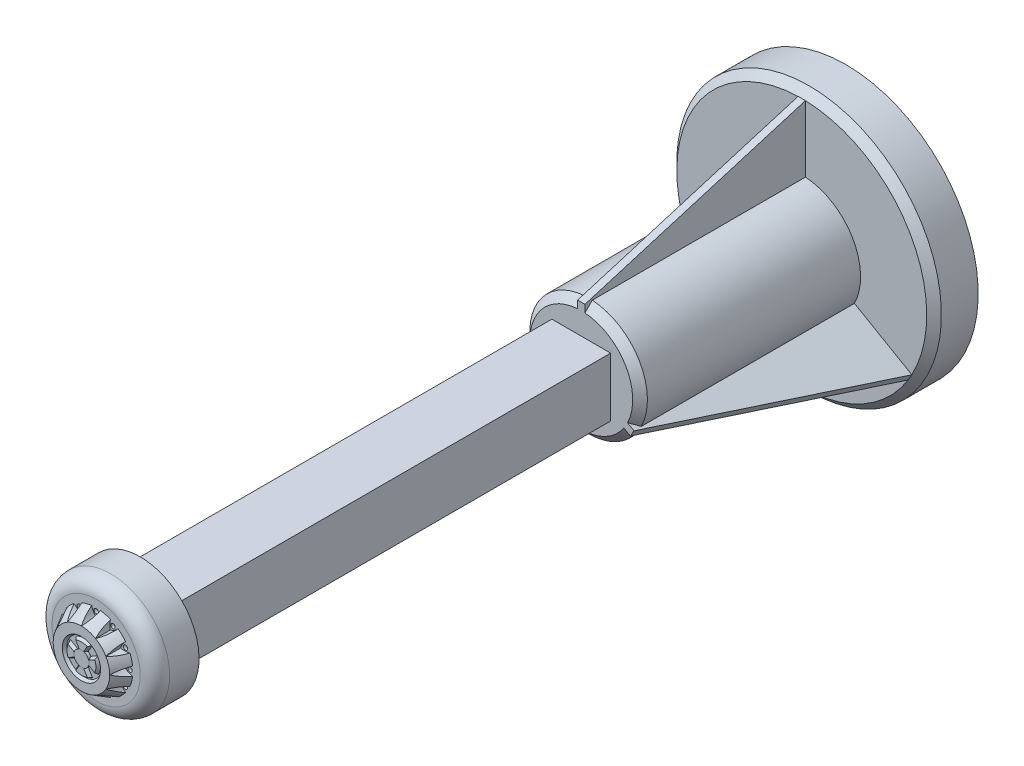
from build123d import *

# Parameters (mm, degrees)
SKETCH1_R                = 90
BOSS_EXTRUDE1_DEPTH      = 30
CHAMFER1_SIZE            = 5
SKETCH2_R                = 40
BOSS_EXTRUDE2_DEPTH      = 150
BOSS_EXTRUDE3_DEPTH      = 2.5
CIRPATTERN1_COUNT        = 3
CHAMFER2_SIZE            = 5
SKETCH6_R                = 10
CUT_EXTRUDE1_DEPTH       = 20
SKETCH7_W                = 40
SKETCH7_H                = 40
BOSS_EXTRUDE4_DEPTH      = 300
SKETCH8_R                = 40
BOSS_EXTRUDE5_DEPTH      = 30
FILLET1_R                = 10
SKETCH9_R                = 25
BOSS_EXTRUDE6_DEPTH      = 10
CHAMFER3_SIZE2           = 5.773502692
CHAMFER3_SIZE            = 10
CUT_EXTRUDE2_START       = -10
CUT_EXTRUDE2_DEPTH       = 10
SKETCH11_R               = 1.5
CUT_EXTRUDE3_DEPTH       = 2
CIRPATTERN2_COUNT        = 12
SKETCH12_R               = 13
CUT_EXTRUDE4_DEPTH       = 2
CUT_EXTRUDE4_DRAFT       = -30
BOSS_EXTRUDE8_DEPTH      = 2
BOSS_EXTRUDE8_DRAFT      = 30
CIRPATTERN3_COPY_1_DEPTH = 2
CIRPATTERN3_COPY_1_DRAFT = 30
CIRPATTERN3_COPY_2_DEPTH = 2
CIRPATTERN3_COPY_2_DRAFT = 30
CIRPATTERN3_COPY_3_DEPTH = 2
CIRPATTERN3_COPY_3_DRAFT = 30
SKETCH14_R               = 5.15
BOSS_EXTRUDE9_DEPTH      = 2
BODY_MOVE_COPY1_ANGLE    = 90


with BuildPart() as part:
    # Sketch1 → Boss-Extrude1 (new body)
    with BuildSketch(Plane(origin=(0, 0, 0), x_dir=(1, 0, 0), z_dir=(0, 1, 0))):
        with Locations(Location((0, 0, 0), (0, 0, 270))):
            Circle(SKETCH1_R)
    extrude(amount=BOSS_EXTRUDE1_DEPTH)

    # Chamfer1
    chamfer1_edges = [part.edges().sort_by_distance(p)[0] for p in [
        (0, 30, -90),
    ]]
    chamfer(chamfer1_edges, length=CHAMFER1_SIZE)

    # Sketch2 → Boss-Extrude2 (add)
    with BuildSketch(Plane(origin=(0, 30, 0), x_dir=(1, 0, 0), z_dir=(0, 1, 0))):
        with Locations(Location((0, 0, 0), (0, 0, 270))):
            Circle(SKETCH2_R)
    extrude(amount=BOSS_EXTRUDE2_DEPTH)

    # Sketch5 → Boss-Extrude3 (add, symmetric)
    with BuildSketch(Plane(origin=(0, 0, 0), x_dir=(0, 0, -1), z_dir=(1, 0, 0))):
        Polygon((0, 30), (0, 180), (40, 180), (85, 30), align=None)
    boss_extrude3 = extrude(amount=BOSS_EXTRUDE3_DEPTH, both=True)

    # CirPattern1: Boss-Extrude3 ×3 about axis
    cirpattern1_axis = Axis((0, 0, 0), (0, 1, 0))
    for i in range(1, CIRPATTERN1_COUNT):
        add(boss_extrude3.rotate(cirpattern1_axis, i * 360 / CIRPATTERN1_COUNT))

    # Chamfer2
    chamfer2_edges = [part.edges().sort_by_distance(p)[0] for p in [
        (-34.641016151, 180, -20),
        (0, 180, 40),
        (34.641016151, 180, -20),
    ]]
    chamfer(chamfer2_edges, length=CHAMFER2_SIZE)

    # Sketch6 → Cut-Extrude1 (cut)
    with BuildSketch(Plane.XZ):
        with Locations(Location((0, 0, 0), (0, 0, 270))):
            Circle(SKETCH6_R)
    extrude(amount=-CUT_EXTRUDE1_DEPTH, mode=Mode.SUBTRACT)

    # Sketch7 → Boss-Extrude4 (add)
    with BuildSketch(Plane(origin=(0, 180, 0), x_dir=(1, 0, 0), z_dir=(0, 1, 0))):
        Rectangle(SKETCH7_W, SKETCH7_H)
    extrude(amount=BOSS_EXTRUDE4_DEPTH)

    # Sketch8 → Boss-Extrude5 (add)
    with BuildSketch(Plane(origin=(0, 480, 0), x_dir=(1, 0, 0), z_dir=(0, 1, 0))):
        with Locations(Location((0, 0, 0), (0, 0, 270))):
            Circle(SKETCH8_R)
    extrude(amount=BOSS_EXTRUDE5_DEPTH)

    # Fillet1
    fillet1_edges = [part.edges().sort_by_distance(p)[0] for p in [
        (0, 510, -40),
    ]]
    fillet(fillet1_edges, radius=FILLET1_R)

    # Sketch9 → Boss-Extrude6 (add)
    with BuildSketch(Plane(origin=(0, 510, 0), x_dir=(1, 0, 0), z_dir=(0, 1, 0))):
        with Locations(Location((0, 0, 0), (0, 0, 270))):
            Circle(SKETCH9_R)
    extrude(amount=BOSS_EXTRUDE6_DEPTH)

    # Chamfer3
    chamfer3_edges = [part.edges().sort_by_distance(p)[0] for p in [
        (0, 520, -25),
    ]]
    chamfer3_side = [part.faces().sort_by_distance(p)[0] for p in [
        (0, 519.884529946, -25),
    ]]
    chamfer(chamfer3_edges, length=CHAMFER3_SIZE - 0.0001, length2=CHAMFER3_SIZE2 - 0.0001, reference=chamfer3_side[0])  # a hair under: the kernel refuses the full size

    # Sketch10 → Cut-Extrude2 (cut)
    with BuildSketch(Plane(origin=(0, 520, 0), x_dir=(1, 0, 0), z_dir=(0, 1, 0)).offset(CUT_EXTRUDE2_START)):
        with BuildLine():
            ThreePointArc((-3, 24.819347292), (-1.876449164, 21.820995287), (0, 19.226497308))
            Line((0, 19.226497308), (0, 25))
            ThreePointArc((0, 25), (-1.502717156, 24.954795955), (-3, 24.819347292))
        make_face()
        with BuildLine():
            Line((0, 25), (0, 19.226497308))
            ThreePointArc((0, 19.226497308), (1.876449164, 21.820995287), (3, 24.819347292))
            ThreePointArc((3, 24.819347292), (1.502717156, 24.954795955), (0, 25))
        make_face()
    cut_extrude2 = extrude(amount=CUT_EXTRUDE2_DEPTH, mode=Mode.SUBTRACT)

    # Sketch11 → Cut-Extrude3 (cut)
    with BuildSketch(Plane(origin=(0, 510, 0), x_dir=(1, 0, 0), z_dir=(0, 1, 0))):
        with Locations(Location((0, 23, 0), (0, 0, 270))):
            Circle(SKETCH11_R)
    cut_extrude3 = extrude(amount=-CUT_EXTRUDE3_DEPTH, mode=Mode.SUBTRACT)

    # CirPattern2: Cut-Extrude2, Cut-Extrude3 ×12 about axis
    cirpattern2_axis = Axis((0, 0, 0), (0, 1, 0))
    add([cut_extrude2.rotate(cirpattern2_axis, i * 360 / CIRPATTERN2_COUNT) for i in range(1, CIRPATTERN2_COUNT)], mode=Mode.SUBTRACT)
    add([cut_extrude3.rotate(cirpattern2_axis, i * 360 / CIRPATTERN2_COUNT) for i in range(1, CIRPATTERN2_COUNT)], mode=Mode.SUBTRACT)


with BuildPart() as cut_extrude4_tool:
    # Sketch12 → Cut-Extrude4 (with draft: the straight prism first)
    with BuildSketch(Plane(origin=(0, 520, 0), x_dir=(1, 0, 0), z_dir=(0, 1, 0))):
        Circle(SKETCH12_R)
    extrude(amount=-CUT_EXTRUDE4_DEPTH)
    # Cut-Extrude4: the draft: its side faces are tilted about the plane it starts from
    cut_extrude4_sides = [cut_extrude4_tool.faces().sort_by_distance(p)[0] for p in [
        (-13, 519, 0),
    ]]
    draft(cut_extrude4_sides, Plane(origin=(0, 520, 0), x_dir=(1, 0, 0), z_dir=(0, 1, 0)), CUT_EXTRUDE4_DRAFT)


with BuildPart() as part_1:
    add(part.part)

    # Cut-Extrude4: cut by cut_extrude4_tool
    add(cut_extrude4_tool.part, mode=Mode.SUBTRACT)


with BuildPart() as boss_extrude8_tool:
    # Sketch13 → Boss-Extrude8 (with draft: the straight prism first)
    with BuildSketch(Plane(origin=(0, 518, 0), x_dir=(1, 0, 0), z_dir=(0, 1, 0))):
        with BuildLine():
            ThreePointArc((-2, 3.464101615), (0, 4), (2, 3.464101615))
            Line((2, 3.464101615), (5.5, 9.526279442))
            ThreePointArc((5.5, 9.526279442), (0, 11), (-5.5, 9.526279442))
            Line((-5.5, 9.526279442), (-2, 3.464101615))
        make_face()
    extrude(amount=BOSS_EXTRUDE8_DEPTH)
    # Boss-Extrude8: the draft: its side faces are tilted about the plane it starts from
    boss_extrude8_sides = [boss_extrude8_tool.faces().sort_by_distance(p)[0] for p in [
        (-3.75, 519, -6.495190528),
        (0, 519, -4),
        (3.75, 519, -6.495190528),
        (0, 519, -11),
    ]]
    draft(boss_extrude8_sides, Plane(origin=(0, 518, 0), x_dir=(1, 0, 0), z_dir=(0, 1, 0)), BOSS_EXTRUDE8_DRAFT)


with BuildPart() as part_2:
    add(part_1.part)

    # Boss-Extrude8: add boss_extrude8_tool
    add(boss_extrude8_tool.part)


with BuildPart() as cirpattern3_copy_1_tool:
    # CirPattern3 copy 1 sketch → CirPattern3 copy 1 (with draft: the straight prism first)
    with BuildSketch(Plane(origin=(0, 518, 0), x_dir=(0, 0, -1), z_dir=(0, 1, 0))):
        with BuildLine():
            ThreePointArc((-2, 3.464101615), (0, 4), (2, 3.464101615))
            Line((2, 3.464101615), (5.5, 9.526279442))
            ThreePointArc((5.5, 9.526279442), (0, 11), (-5.5, 9.526279442))
            Line((-5.5, 9.526279442), (-2, 3.464101615))
        make_face()
    extrude(amount=CIRPATTERN3_COPY_1_DEPTH)
    # CirPattern3 copy 1: the draft: its side faces are tilted about the plane it starts from
    cirpattern3_copy_1_sides = [cirpattern3_copy_1_tool.faces().sort_by_distance(p)[0] for p in [
        (-6.495190528, 519, 3.75),
        (-4, 519, 0),
        (-6.495190528, 519, -3.75),
        (-11, 519, 0),
    ]]
    draft(cirpattern3_copy_1_sides, Plane(origin=(0, 518, 0), x_dir=(0, 0, -1), z_dir=(0, 1, 0)), CIRPATTERN3_COPY_1_DRAFT)


with BuildPart() as part_3:
    add(part_2.part)

    # CirPattern3 copy 1: add cirpattern3_copy_1_tool
    add(cirpattern3_copy_1_tool.part)


with BuildPart() as cirpattern3_copy_2_tool:
    # CirPattern3 copy 2 sketch → CirPattern3 copy 2 (with draft: the straight prism first)
    with BuildSketch(Plane(origin=(0, 518, 0), x_dir=(-1, 0, 0), z_dir=(0, 1, 0))):
        with BuildLine():
            ThreePointArc((-2, 3.464101615), (0, 4), (2, 3.464101615))
            Line((2, 3.464101615), (5.5, 9.526279442))
            ThreePointArc((5.5, 9.526279442), (0, 11), (-5.5, 9.526279442))
            Line((-5.5, 9.526279442), (-2, 3.464101615))
        make_face()
    extrude(amount=CIRPATTERN3_COPY_2_DEPTH)
    # CirPattern3 copy 2: the draft: its side faces are tilted about the plane it starts from
    cirpattern3_copy_2_sides = [cirpattern3_copy_2_tool.faces().sort_by_distance(p)[0] for p in [
        (3.75, 519, 6.495190528),
        (0, 519, 4),
        (-3.75, 519, 6.495190528),
        (0, 519, 11),
    ]]
    draft(cirpattern3_copy_2_sides, Plane(origin=(0, 518, 0), x_dir=(-1, 0, 0), z_dir=(0, 1, 0)), CIRPATTERN3_COPY_2_DRAFT)


with BuildPart() as part_4:
    add(part_3.part)

    # CirPattern3 copy 2: add cirpattern3_copy_2_tool
    add(cirpattern3_copy_2_tool.part)


with BuildPart() as cirpattern3_copy_3_tool:
    # CirPattern3 copy 3 sketch → CirPattern3 copy 3 (with draft: the straight prism first)
    with BuildSketch(Plane.ZX.offset(518)):
        with BuildLine():
            ThreePointArc((-2, 3.464101615), (0, 4), (2, 3.464101615))
            Line((2, 3.464101615), (5.5, 9.526279442))
            ThreePointArc((5.5, 9.526279442), (0, 11), (-5.5, 9.526279442))
            Line((-5.5, 9.526279442), (-2, 3.464101615))
        make_face()
    extrude(amount=CIRPATTERN3_COPY_3_DEPTH)
    # CirPattern3 copy 3: the draft: its side faces are tilted about the plane it starts from
    cirpattern3_copy_3_sides = [cirpattern3_copy_3_tool.faces().sort_by_distance(p)[0] for p in [
        (6.495190528, 519, -3.75),
        (4, 519, 0),
        (6.495190528, 519, 3.75),
        (11, 519, 0),
    ]]
    draft(cirpattern3_copy_3_sides, Plane.ZX.offset(518), CIRPATTERN3_COPY_3_DRAFT)


with BuildPart() as part_5:
    add(part_4.part)

    # CirPattern3 copy 3: add cirpattern3_copy_3_tool
    add(cirpattern3_copy_3_tool.part)

    # Sketch14 → Boss-Extrude9 (add)
    with BuildSketch(Plane(origin=(0, 518, 0), x_dir=(1, 0, 0), z_dir=(0, 1, 0))):
        with Locations(Location((0, 0, 0), (0, 0, 107.097010769))):
            Circle(SKETCH14_R)
    extrude(amount=BOSS_EXTRUDE9_DEPTH)


with BuildPart() as part_6:
    # Body-Move/Copy1: read off the stored shape, not the designer's step
    # Body-Move/Copy1: moved
    add(part_5.part.rotate(Axis((0, 0, 0), (1, 0, 0)), BODY_MOVE_COPY1_ANGLE))


with BuildPart() as part_7:
    # Body-Move/Copy2: moved
    add(part_6.part.moved(Location((0, 0, -217.50000005))))


solid = part_7.part
